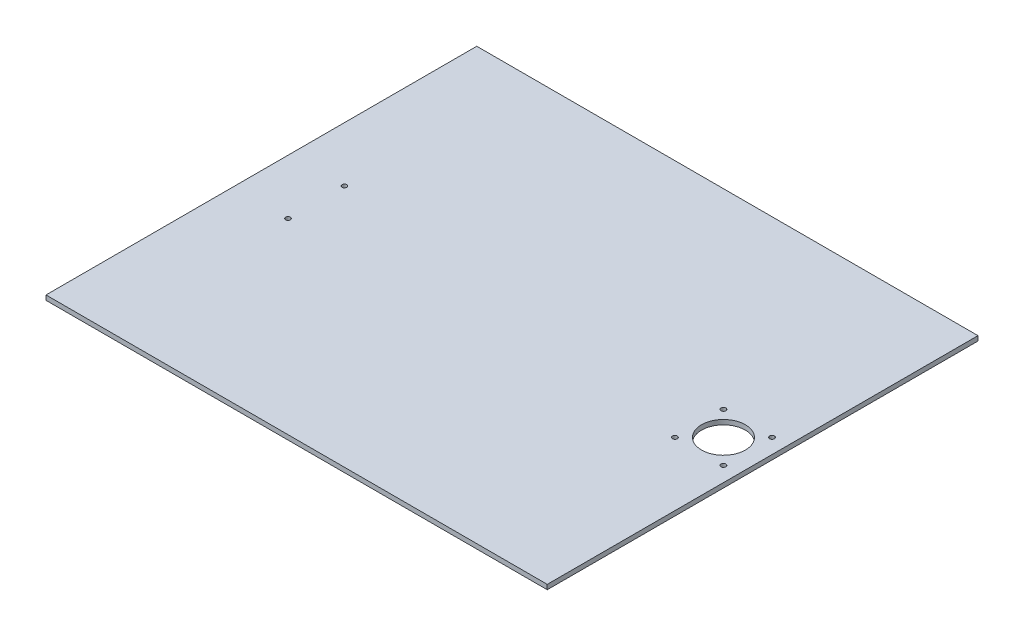
from build123d import *

# Parameters (mm, degrees)
SKETCH1_W                      = 320
SKETCH1_H                      = 275
BOSS_EXTRUDE1_DEPTH            = 3
TALADRO_DE_MARGEN_PARA_M2_51_D = 3.1
SKETCH6_R                      = 1.5
CUT_EXTRUDE1_DEPTH             = 211.986373968
SKETCH7_R                      = 14
CUT_EXTRUDE2_DEPTH             = 10


with BuildPart() as part:
    # Sketch1 → Boss-Extrude1 (new body)
    with BuildSketch(Plane(origin=(0, 0, 0), x_dir=(1, 0, 0), z_dir=(0, 1, 0))):
        Rectangle(SKETCH1_W, SKETCH1_H)
    extrude(amount=BOSS_EXTRUDE1_DEPTH)

    # Taladro de margen para M2.51 (through all)
    with Locations(Plane(origin=(0, 3, 0), x_dir=(1, 0, 0), z_dir=(0, 1, 0))):
        with Locations((150.5, 15.5), (150.5, -15.5), (119.5, -15.5), (119.5, 15.5)):
            Hole(TALADRO_DE_MARGEN_PARA_M2_51_D / 2)

    # Sketch6 → Cut-Extrude1 (cut, through all)
    with BuildSketch(Plane(origin=(0, 3, 0), x_dir=(1, 0, 0), z_dir=(0, 1, 0))):
        with Locations((-125, -18)):
            Circle(SKETCH6_R)
        with Locations((-125, 18)):
            Circle(SKETCH6_R)
    extrude(amount=-CUT_EXTRUDE1_DEPTH, mode=Mode.SUBTRACT)

    # Sketch7 → Cut-Extrude2 (cut)
    with BuildSketch(Plane(origin=(0, 3, 0), x_dir=(1, 0, 0), z_dir=(0, 1, 0))):
        with Locations((135, -1e-09)):
            Circle(SKETCH7_R)
    extrude(amount=-CUT_EXTRUDE2_DEPTH, mode=Mode.SUBTRACT)


solid = part.part
